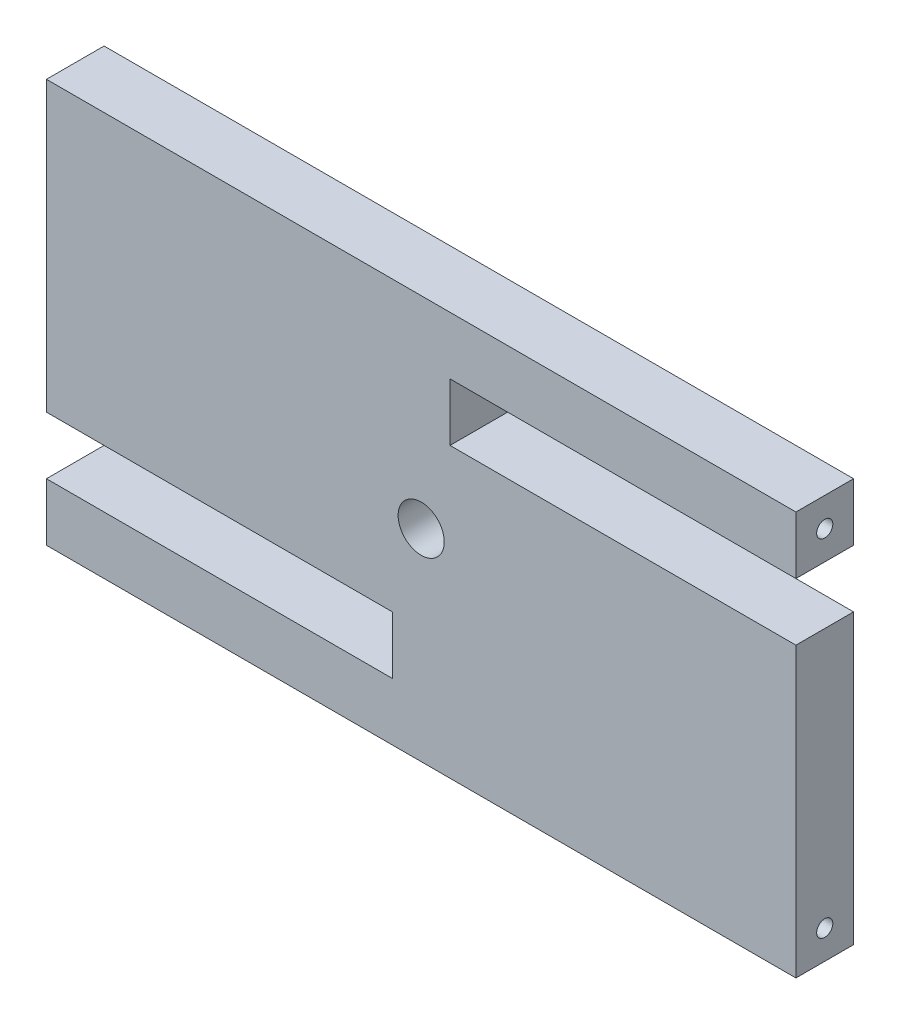
from build123d import *

# Parameters (mm, degrees)
SKETCH1_R           = 4
BOSS_EXTRUDE2_DEPTH = 10
SKETCH2_R           = 1.4
CUT_EXTRUDE1_DEPTH  = 10
CUT_EXTRUDE2_START  = -10
SKETCH3_R           = 1.4
CUT_EXTRUDE2_DEPTH  = 10


with BuildPart() as part:
    # Sketch1 → Boss-Extrude2 (new body)
    with BuildSketch(Plane.XY):
        Polygon((-115, 35), (15, 35), (15, 25), (-45, 25), (-45, 15), (15, 15), (15, -35), (-115, -35), (-115, -25), (-55, -25), (-55, -15), (-115, -15), align=None)
        with Locations((-50, 0)):
            Circle(SKETCH1_R, mode=Mode.SUBTRACT)
    extrude(amount=BOSS_EXTRUDE2_DEPTH)

    # Sketch2 → Cut-Extrude1 (cut)
    with BuildSketch(Plane.ZY.offset(115)):
        with Locations((5, 30)):
            Circle(SKETCH2_R)
        with Locations((5, -30)):
            Circle(SKETCH2_R)
    extrude(amount=-CUT_EXTRUDE1_DEPTH, mode=Mode.SUBTRACT)

    # Sketch3 → Cut-Extrude2 (cut)
    with BuildSketch(Plane(origin=(15, 0, 0), x_dir=(0, 0, -1), z_dir=(1, 0, 0)).offset(CUT_EXTRUDE2_START)):
        with Locations((-5, -30)):
            Circle(SKETCH3_R)
        with Locations((-5, 30)):
            Circle(SKETCH3_R)
    extrude(amount=CUT_EXTRUDE2_DEPTH, mode=Mode.SUBTRACT)


solid = part.part
